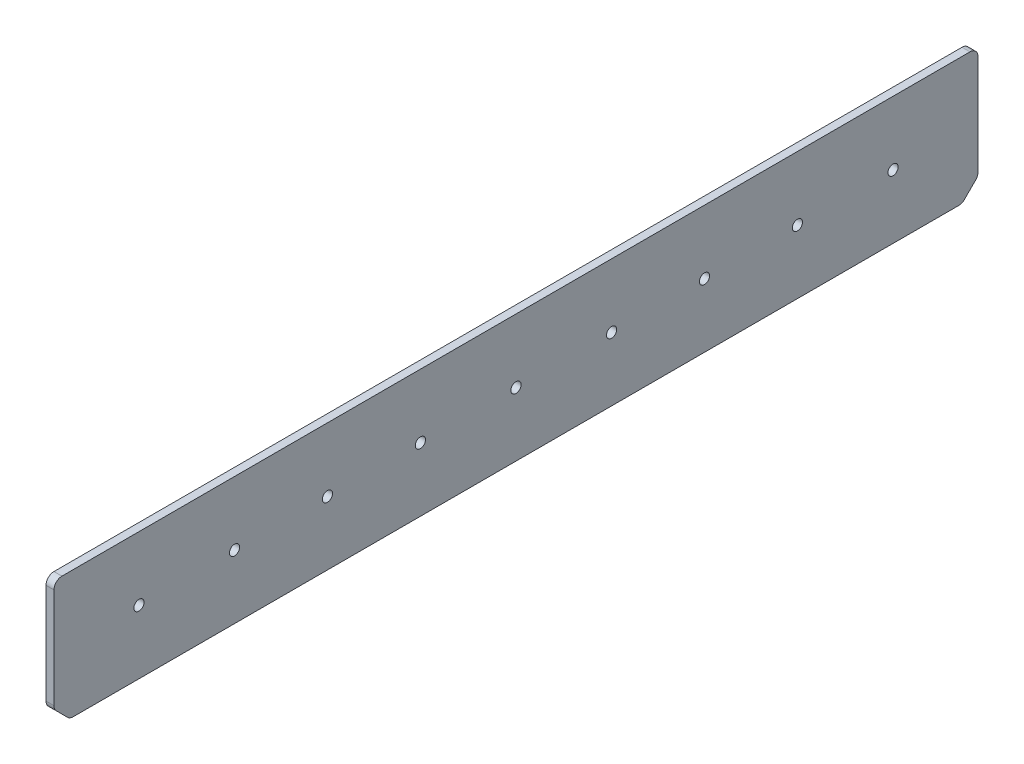
from build123d import *

# Parameters (mm, degrees)
SKETCH1_W           = 368.3
SKETCH1_H           = 50.8
BOSS_EXTRUDE1_DEPTH = 3.175
SKETCH2_R           = 2.032
CUT_EXTRUDE1_DEPTH  = 372.80049842
CHAMFER1_SIZE       = 6.35
FILLET1_R           = 3.175


with BuildPart() as part:
    # Sketch1 → Boss-Extrude1 (new body)
    with BuildSketch(Plane(origin=(0, 0, 0), x_dir=(0, 0, -1), z_dir=(1, 0, 0))):
        with Locations((184.15, 25.4)):
            Rectangle(SKETCH1_W, SKETCH1_H)
    extrude(amount=BOSS_EXTRUDE1_DEPTH)

    # Sketch2 → Cut-Extrude1 (cut, through all)
    with BuildSketch(Plane(origin=(3.175, 0, 0), x_dir=(0, 0, -1), z_dir=(1, 0, 0))):
        with Locations((334.433333333, 25.4)):
            Circle(SKETCH2_R)
        with Locations((296.333333333, 25.4)):
            Circle(SKETCH2_R)
        with Locations((259.291666667, 25.4)):
            Circle(SKETCH2_R)
        with Locations((222.25, 25.4)):
            Circle(SKETCH2_R)
        with Locations((184.15, 25.4)):
            Circle(SKETCH2_R)
        with Locations((146.05, 25.4)):
            Circle(SKETCH2_R)
        with Locations((109.008333333, 25.4)):
            Circle(SKETCH2_R)
        with Locations((71.966666667, 25.4)):
            Circle(SKETCH2_R)
        with Locations((33.866666667, 25.4)):
            Circle(SKETCH2_R)
    extrude(amount=-CUT_EXTRUDE1_DEPTH, mode=Mode.SUBTRACT)

    # Chamfer1
    chamfer1_edges = [part.edges().sort_by_distance(p)[0] for p in [
        (1.5875, 0, 0),
        (1.5875, 0, -368.3),
    ]]
    chamfer(chamfer1_edges, length=CHAMFER1_SIZE)

    # Fillet1
    fillet1_edges = [part.edges().sort_by_distance(p)[0] for p in [
        (1.5875, 0, -361.95),
        (1.5875, 6.35, -368.3),
        (1.5875, 50.8, -368.3),
        (1.5875, 0, -6.35),
        (1.5875, 6.35, 0),
        (1.5875, 50.8, 0),
    ]]
    fillet(fillet1_edges, radius=FILLET1_R)


solid = part.part
